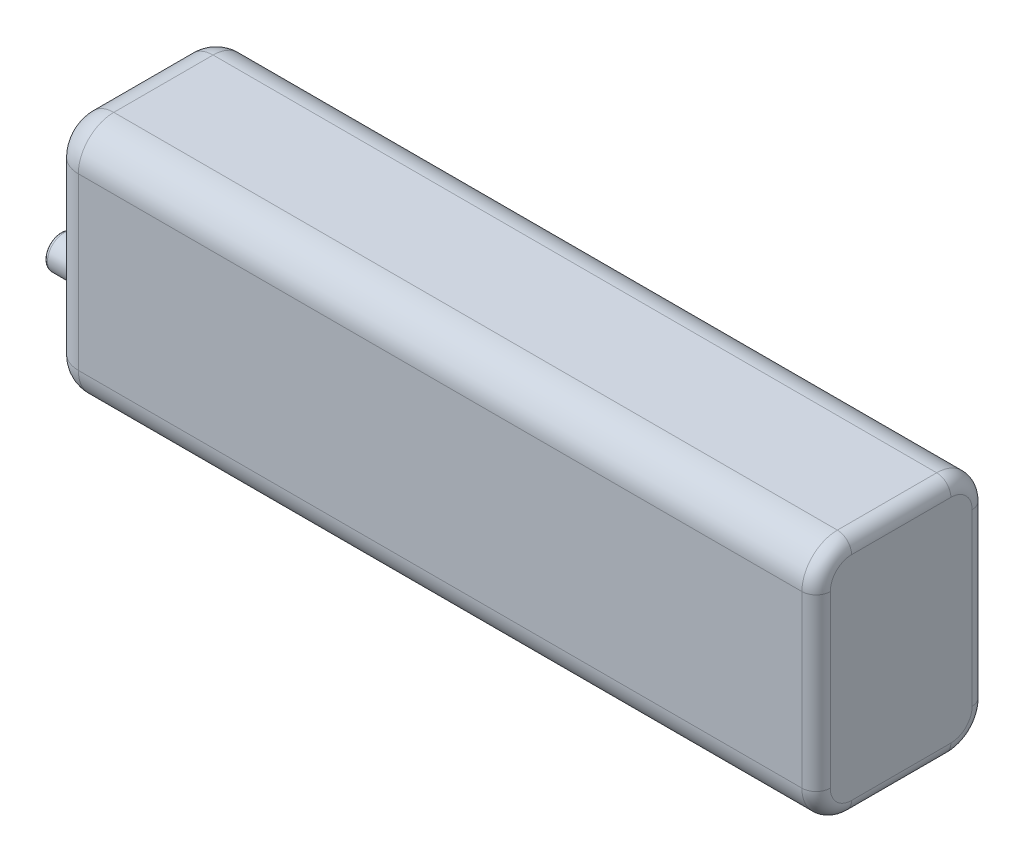
from build123d import *

# Parameters (mm, degrees)
SKETCH1_W           = 108
SKETCH1_H           = 34
BOSS_EXTRUDE1_DEPTH = 24
FILLET1_R           = 5
SKETCH2_W           = 11.95330434
SKETCH2_H           = 8.370070963
BOSS_EXTRUDE2_DEPTH = 3
SKETCH4_R           = 2.331694998
BOSS_EXTRUDE3_DEPTH = 8
FILLET2_R           = 0.5
CHAMFER1_SIZE       = 1
FILLET4_R           = 4
FILLET5_R           = 2


with BuildPart() as part:
    # Sketch1 → Boss-Extrude1 (new body)
    with BuildSketch(Plane.XY):
        Rectangle(SKETCH1_W, SKETCH1_H)
    extrude(amount=BOSS_EXTRUDE1_DEPTH)

    # Fillet1
    fillet1_edges = [part.edges().sort_by_distance(p)[0] for p in [
        (0, -17, 24),
        (0, -17, 0),
        (0, 17, 0),
        (0, 17, 24),
    ]]
    fillet(fillet1_edges, radius=FILLET1_R)

    # Sketch2 → Boss-Extrude2 (add)
    with BuildSketch(Plane.ZY.offset(54)):
        with Locations((11.64622902, -7.901268425)):
            Rectangle(SKETCH2_W, SKETCH2_H)
    extrude(amount=BOSS_EXTRUDE2_DEPTH)

    # Sketch4 → Boss-Extrude3 (add)
    with BuildSketch(Plane.ZY.offset(54)):
        with Locations(Location((14.518147435, -8.031501174, 0), (0, 0, 180))):
            Circle(SKETCH4_R)
        with Locations(Location((9.050368945, -8.031501174, 0), (0, 0, 180))):
            Circle(SKETCH4_R)
    extrude(amount=BOSS_EXTRUDE3_DEPTH)

    # Fillet2
    fillet2_edges = [part.edges().sort_by_distance(p)[0] for p in [
        (-62, -8.031501174, 16.849842433),
        (-62, -8.031501174, 11.382063944),
    ]]
    fillet(fillet2_edges, radius=FILLET2_R)

    # Chamfer1
    # the kernel refuses this chamfer: 1 mm, written as the material it takes off along each edge
    with BuildSketch(Plane(origin=(-57, -14.657986894, 17.62288119), x_dir=(-0.0274958766105891, 0, -0.9996219169112968), z_dir=(0, 1, 0))) as chamfer1_piece_1_section:
        Polygon((CHAMFER1_SIZE * 0.999621916911, -CHAMFER1_SIZE * 0.0274958766106), (-CHAMFER1_SIZE * 0.0274958766106, -CHAMFER1_SIZE * 0.999621916911), (0, 0), align=None)
    chamfer1_piece_1 = extrude(amount=13.513436938, mode=Mode.PRIVATE)
    chamfer1_piece_1 = chamfer1_piece_1 - Plane(origin=(-56.66854021, -8.031501174, 14.518147435), x_dir=(0, 0, -1), z_dir=(1, 0, 0)) * Cylinder(2.331694998, 32, mode=Mode.PRIVATE)
    add(chamfer1_piece_1, mode=Mode.SUBTRACT)
    with BuildSketch(Plane(origin=(-57, -3.716232943, 20.194564177), x_dir=(-0.02749587661058907, -0.9996219169112965, 0), z_dir=(0, 0, -1)), Plane(origin=(-57, -12.086303906, 3.097893862), x_dir=(-0.0274958766105891, 0.9996219169112968, 0), z_dir=(0, 0, 1))) as chamfer1_piece_2:
        Polygon((CHAMFER1_SIZE * 0.999621916911, -CHAMFER1_SIZE * 0.0274958766106), (-CHAMFER1_SIZE * 0.0274958766106, -CHAMFER1_SIZE * 0.999621916911), (0, 0), align=None)
    extrude(amount=17.096670315, mode=Mode.SUBTRACT)
    with BuildSketch(Plane(origin=(-57, -1.144549955, 5.66957685), x_dir=(-0.02749587661058907, 0, 0.9996219169112965), z_dir=(0, -1, 0))) as chamfer1_piece_3:
        Polygon((CHAMFER1_SIZE * 0.999621916911, -CHAMFER1_SIZE * 0.0274958766106), (-CHAMFER1_SIZE * 0.0274958766106, -CHAMFER1_SIZE * 0.999621916911), (0, 0), align=None)
    extrude(amount=13.513436938, mode=Mode.SUBTRACT)

    # Fillet4
    fillet4_edges = [part.edges().sort_by_distance(p)[0] for p in [
        (-54, 17, 12),
        (-54, 0, 0),
        (-54, -17, 12),
        (-54, 0, 24),
        (-54, -15.535533906, 22.535533906),
        (-54, -15.535533906, 1.464466094),
        (-54, 15.535533906, 22.535533906),
        (-54, 15.535533906, 1.464466094),
    ]]
    fillet(fillet4_edges, radius=FILLET4_R)

    # Fillet5
    fillet5_edges = [part.edges().sort_by_distance(p)[0] for p in [
        (54, 17, 12),
        (54, 0, 0),
        (54, 0, 24),
        (54, -17, 12),
        (54, -15.535533906, 22.535533906),
        (54, -15.535533906, 1.464466094),
        (54, 15.535533906, 22.535533906),
        (54, 15.535533906, 1.464466094),
    ]]
    fillet(fillet5_edges, radius=FILLET5_R)


solid = part.part
